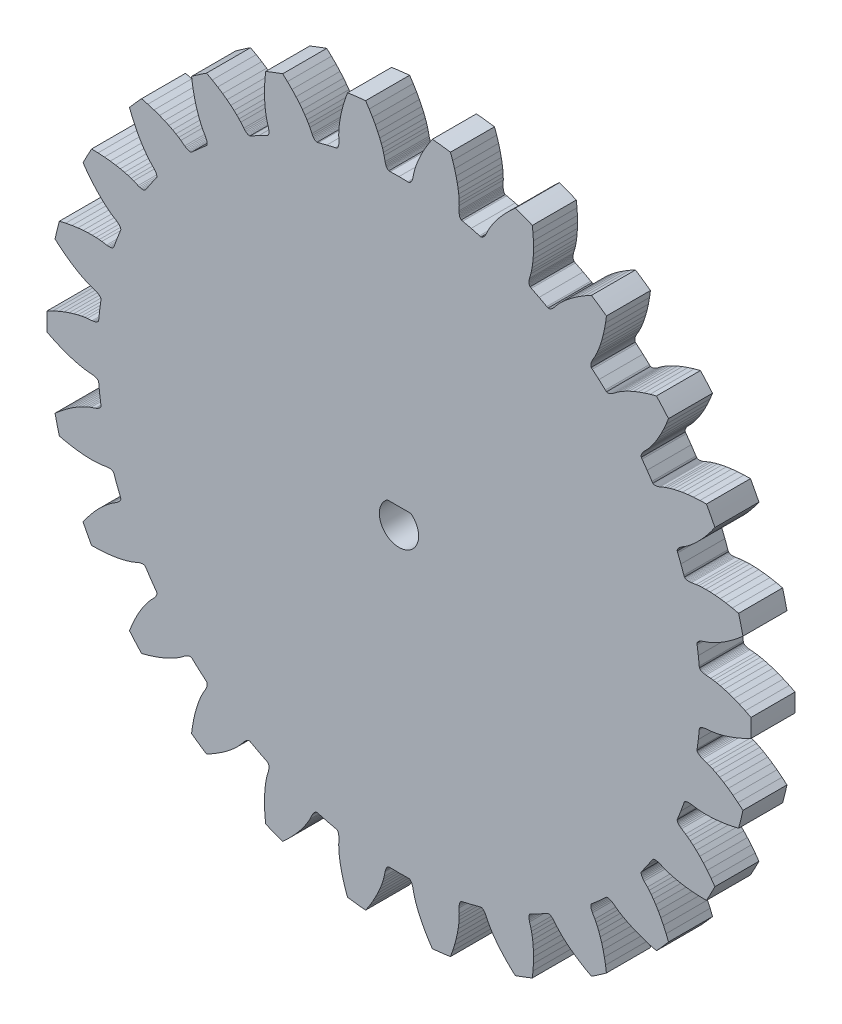
from build123d import *

# Parameters (mm, degrees)
MODEL_R             = 2.5
BOSS_EXTRUDE1_DEPTH = 7
CUT_EXTRUDE1_DEPTH  = 80.327044596


with BuildPart() as part:
    # Model → Boss-Extrude1 (new body)
    with BuildSketch(Plane.XY):
        with BuildLine():
            Line((53.1145369, 10.6909188), (53.9185912, 11.3234084))
            Line((53.9185912, 11.3234084), (54.700837925, 11.992224127))
            ThreePointArc((54.700837925, 11.992224127), (54.372699629, 13.40166681), (54.00825103, 14.802159807))
            Line((54.00825103, 14.802159807), (53.0047917, 15.0308385))
            Line((53.0047917, 15.0308385), (51.9989045, 15.2172176))
            Line((51.9989045, 15.2172176), (51.0709493, 15.3492608))
            Line((51.0709493, 15.3492608), (50.2227788, 15.4339274))
            Line((50.2227788, 15.4339274), (49.4587592, 15.4780067))
            Line((49.4587592, 15.4780067), (48.7788318, 15.48876))
            Line((48.7788318, 15.48876), (48.184081, 15.4732826))
            Line((48.184081, 15.4732826), (47.6758858, 15.4387394))
            Line((47.6758858, 15.4387394), (47.2557344, 15.3924859))
            Line((47.2557344, 15.3924859), (46.5056239, 15.2698861))
            Line((46.5056239, 15.2698861), (46.2943856, 15.2490778))
            Line((46.2943856, 15.2490778), (46.1029098, 15.2433899))
            Line((46.1029098, 15.2433899), (45.9317238, 15.2519957))
            Line((45.9317238, 15.2519957), (45.7813225, 15.2740135))
            Line((45.7813225, 15.2740135), (45.652196, 15.3086023))
            Line((45.652196, 15.3086023), (45.544796, 15.3548533))
            Line((45.544796, 15.3548533), (45.4595411, 15.4118878))
            Line((45.4595411, 15.4118878), (45.3968175, 15.4787721))
            Line((45.3968175, 15.4787721), (45.3570103, 15.5546041))
            Line((45.3570103, 15.5546041), (45.3057091, 15.7038618))
            Line((45.3057091, 15.7038618), (44.8340288, 17.0033043))
            Line((44.8340288, 17.0033043), (44.3253968, 18.2887329))
            Line((44.3253968, 18.2887329), (44.2648202, 18.4344729))
            Line((44.2648202, 18.4344729), (44.2443304, 18.517631))
            Line((44.2443304, 18.517631), (44.2469271, 18.609288))
            Line((44.2469271, 18.609288), (44.2729204, 18.7085134))
            Line((44.2729204, 18.7085134), (44.3226405, 18.8143522))
            Line((44.3226405, 18.8143522), (44.3963564, 18.925869))
            Line((44.3963564, 18.925869), (44.4943329, 19.042084))
            Line((44.4943329, 19.042084), (44.6167607, 19.1620429))
            Line((44.6167607, 19.1620429), (44.7638542, 19.2847575))
            Line((44.7638542, 19.2847575), (44.9357668, 19.4092591))
            Line((44.9357668, 19.4092591), (45.5785313, 19.8149071))
            Line((45.5785313, 19.8149071), (45.9236908, 20.0588977))
            Line((45.9236908, 20.0588977), (46.3269868, 20.3700375))
            Line((46.3269868, 20.3700375), (46.7824276, 20.7528453))
            Line((46.7824276, 20.7528453), (47.2842298, 21.2117694))
            Line((47.2842298, 21.2117694), (47.8268767, 21.751402))
            Line((47.8268767, 21.751402), (48.4055971, 22.3772169))
            Line((48.4055971, 22.3772169), (49.0126207, 23.0914008))
            Line((49.0126207, 23.0914008), (49.6419459, 23.8979342))
            Line((49.6419459, 23.8979342), (50.241403889, 24.734519343))
            ThreePointArc((50.241403889, 24.734519343), (49.585498769, 26.024477381), (48.896480705, 27.297056406))
            Line((48.896480705, 27.297056406), (47.8674537, 27.2789466))
            Line((47.8674537, 27.2789466), (46.8461923, 27.2191853))
            Line((46.8461923, 27.2191853), (45.9136017, 27.1253174))
            Line((45.9136017, 27.1253174), (45.0698155, 27.0045432))
            Line((45.0698155, 27.0045432), (44.3174481, 26.8644998))
            Line((44.3174481, 26.8644998), (43.6547047, 26.7122233))
            Line((43.6547047, 26.7122233), (43.0809402, 26.5548625))
            Line((43.0809402, 26.5548625), (42.595779, 26.3997039))
            Line((42.595779, 26.3997039), (42.1989057, 26.2542458))
            Line((42.1989057, 26.2542458), (41.4999321, 25.9556952))
            Line((41.4999321, 25.9556952), (41.2998117, 25.8849389))
            Line((41.2998117, 25.8849389), (41.115261, 25.8335931))
            Line((41.115261, 25.8335931), (40.9469899, 25.8009814))
            Line((40.9469899, 25.8009814), (40.7956898, 25.786366))
            Line((40.7956898, 25.786366), (40.6620379, 25.7890478))
            Line((40.6620379, 25.7890478), (40.54669, 25.8082523))
            Line((40.54669, 25.8082523), (40.4502632, 25.8432266))
            Line((40.4502632, 25.8432266), (40.3733559, 25.8931567))
            Line((40.3733559, 25.8931567), (40.3165576, 25.9572587))
            Line((40.3165576, 25.9572587), (40.2310274, 26.089902))
            Line((40.2310274, 26.089902), (39.4620764, 27.2387046))
            Line((39.4620764, 27.2387046), (38.660601, 28.3650573))
            Line((38.660601, 28.3650573), (38.5669068, 28.4920654))
            Line((38.5669068, 28.4920654), (38.5271114, 28.5679036))
            Line((38.5271114, 28.5679036), (38.5076977, 28.6575187))
            Line((38.5076977, 28.6575187), (38.5091895, 28.7600814))
            Line((38.5091895, 28.7600814), (38.5321359, 28.8747435))
            Line((38.5321359, 28.8747435), (38.5770221, 29.0006612))
            Line((38.5770221, 29.0006612), (38.6443394, 29.1369465))
            Line((38.6443394, 29.1369465), (38.7345017, 29.2827185))
            Line((38.7345017, 29.2827185), (38.8479534, 29.437069))
            Line((38.8479534, 29.437069), (38.9850754, 29.5990942))
            Line((38.9850754, 29.5990942), (39.5120844, 30.1467784))
            Line((39.5120844, 30.1467784), (39.7888234, 30.4662812))
            Line((39.7888234, 30.4662812), (40.1059397, 30.8648949))
            Line((40.1059397, 30.8648949), (40.4565343, 31.3455731))
            Line((40.4565343, 31.3455731), (40.8339273, 31.9112508))
            Line((40.8339273, 31.9112508), (41.2316633, 32.5650666))
            Line((41.2316633, 32.5650666), (41.6437999, 33.3111933))
            Line((41.6437999, 33.3111933), (42.0622691, 34.1498945))
            Line((42.0622691, 34.1498945), (42.4802912, 35.0835989))
            Line((42.4802912, 35.0835989), (42.86212209, 36.03933398))
            ThreePointArc((42.86212209, 36.03933398), (41.916568958, 37.13483965), (40.943024605, 38.205547261))
            Line((40.943024605, 38.205547261), (39.9482332, 37.9417015))
            Line((39.9482332, 37.9417015), (38.9709496, 37.6392729))
            Line((38.9709496, 37.6392729), (38.0879226, 37.324949))
            Line((38.0879226, 37.324949), (37.2975584, 37.0057531))
            Line((37.2975584, 37.0057531), (36.6005679, 36.6897258))
            Line((36.6005679, 36.6897258), (35.9935249, 36.3832693))
            Line((35.9935249, 36.3832693), (35.4740919, 36.0931703))
            Line((35.4740919, 36.0931703), (35.0401604, 35.8264137))
            Line((35.0401604, 35.8264137), (34.6896299, 35.5902042))
            Line((34.6896299, 35.5902042), (34.082415, 35.1330537))
            Line((34.082415, 35.1330537), (33.9050429, 35.0164615))
            Line((33.9050429, 35.0164615), (33.7381428, 34.9224419))
            Line((33.7381428, 34.9224419), (33.5825658, 34.8505079))
            Line((33.5825658, 34.8505079), (33.4391599, 34.8001087))
            Line((33.4391599, 34.8001087), (33.3087498, 34.7707275))
            Line((33.3087498, 34.7707275), (33.1921579, 34.7617694))
            Line((33.1921579, 34.7617694), (33.0901632, 34.772651))
            Line((33.0901632, 34.772651), (33.0035415, 34.8027251))
            Line((33.0035415, 34.8027251), (32.9330531, 34.8513717))
            Line((32.9330531, 34.8513717), (32.8182646, 34.9596919))
            Line((32.8182646, 34.9596919), (31.7967315, 35.8910904))
            Line((31.7967315, 35.8910904), (30.7489917, 36.7929077))
            Line((30.7489917, 36.7929077), (30.627625, 36.8938027))
            Line((30.627625, 36.8938027), (30.5708367, 36.9579135))
            Line((30.5708367, 36.9579135), (30.5305408, 37.0402785))
            Line((30.5305408, 37.0402785), (30.5074444, 37.140218))
            Line((30.5074444, 37.140218), (30.5022836, 37.2570396))
            Line((30.5022836, 37.2570396), (30.5157314, 37.3900403))
            Line((30.5157314, 37.3900403), (30.5484774, 37.5384756))
            Line((30.5484774, 37.5384756), (30.6011342, 37.7015889))
            Line((30.6011342, 37.7015889), (30.6743508, 37.878605))
            Line((30.6743508, 37.878605), (30.7687131, 38.0687375))
            Line((30.7687131, 38.0687375), (31.1493387, 38.7266285))
            Line((31.1493387, 38.7266285), (31.3415742, 39.1030751))
            Line((31.3415742, 39.1030751), (31.5540812, 39.5659967))
            Line((31.5540812, 39.5659967), (31.7794543, 40.1166101))
            Line((31.7794543, 40.1166101), (32.0105054, 40.7561663))
            Line((32.0105054, 40.7561663), (32.2402156, 41.4861678))
            Line((32.2402156, 41.4861678), (32.4618164, 42.3092442))
            Line((32.4618164, 42.3092442), (32.6674113, 43.2237205))
            Line((32.6674113, 43.2237205), (32.8498364, 44.2303324))
            Line((32.8498364, 44.2303324), (32.991849572, 45.249673828))
            ThreePointArc((32.991849572, 45.249673828), (31.81160102, 46.087060609), (30.610108842, 46.893670685))
            Line((30.610108842, 46.893670685), (29.7073667, 46.3994226))
            Line((29.7073667, 46.3994226), (28.8308571, 45.8719027))
            Line((28.8308571, 45.8719027), (28.0487118, 45.3553904))
            Line((28.0487118, 45.3553904), (27.3577028, 44.8563231))
            Line((27.3577028, 44.8563231), (26.7565959, 44.3826783))
            Line((26.7565959, 44.3826783), (26.2405322, 43.9398519))
            Line((26.2405322, 43.9398519), (25.8056182, 43.5338742))
            Line((25.8056182, 43.5338742), (25.448135, 43.1710225))
            Line((25.448135, 43.1710225), (25.1643189, 42.8577894))
            Line((25.1643189, 42.8577894), (24.6841519, 42.2686068))
            Line((24.6841519, 42.2686068), (24.5398362, 42.1129547))
            Line((24.5398362, 42.1129547), (24.4002863, 41.9817252))
            Line((24.4002863, 41.9817252), (24.266445, 41.8746495))
            Line((24.266445, 41.8746495), (24.1392675, 41.7913956))
            Line((24.1392675, 41.7913956), (24.0196783, 41.731659))
            Line((24.0196783, 41.731659), (23.9086182, 41.6950589))
            Line((23.9086182, 41.6950589), (23.8069831, 41.6812154))
            Line((23.8069831, 41.6812154), (23.7156813, 41.6896856))
            Line((23.7156813, 41.6896856), (23.6355993, 41.7200496))
            Line((23.6355993, 41.7200496), (23.4982236, 41.7977516))
            Line((23.4982236, 41.7977516), (22.2834761, 42.4576164))
            Line((22.2834761, 42.4576164), (21.0503627, 43.0824881))
            Line((21.0503627, 43.0824881), (20.908377, 43.1514063))
            Line((20.908377, 43.1514063), (20.8378961, 43.2000638))
            Line((20.8378961, 43.2000638), (20.7790599, 43.270392))
            Line((20.7790599, 43.270392), (20.7327176, 43.3619001))
            Line((20.7327176, 43.3619001), (20.6997495, 43.474092))
            Line((20.6997495, 43.474092), (20.6809774, 43.6064463))
            Line((20.6809774, 43.6064463), (20.677249, 43.7584049))
            Line((20.677249, 43.7584049), (20.6893401, 43.92938))
            Line((20.6893401, 43.92938), (20.7180664, 44.1187742))
            Line((20.7180664, 44.1187742), (20.764185, 44.3259642))
            Line((20.764185, 44.3259642), (20.9763067, 45.0558278))
            Line((20.9763067, 45.0558278), (21.0728666, 45.4673405))
            Line((21.0728666, 45.4673405), (21.1684141, 45.9676667))
            Line((21.1684141, 45.9676667), (21.2554679, 46.5562155))
            Line((21.2554679, 46.5562155), (21.3267493, 47.2324816))
            Line((21.3267493, 47.2324816), (21.3750837, 47.9962438))
            Line((21.3750837, 47.9962438), (21.3932701, 48.8484356))
            Line((21.3932701, 48.8484356), (21.3740423, 49.785541))
            Line((21.3740423, 49.785541), (21.3102684, 50.8065597))
            Line((21.3102684, 50.8065597), (21.20421064, 51.830266876))
            ThreePointArc((21.20421064, 51.830266876), (19.857858064, 52.360868552), (18.498244695, 52.856504393))
            Line((18.498244695, 52.856504393), (17.740016, 52.1605779))
            Line((17.740016, 52.1605779), (17.0152199, 51.4386243))
            Line((17.0152199, 51.4386243), (16.3794118, 50.7499412))
            Line((16.3794118, 50.7499412), (15.8279169, 50.1000067))
            Line((15.8279169, 50.1000067), (15.3576277, 49.4962708))
            Line((15.3576277, 49.4962708), (14.9625352, 48.9428101))
            Line((14.9625352, 48.9428101), (14.6374158, 48.4445476))
            Line((14.6374158, 48.4445476), (14.3771566, 48.0066883))
            Line((14.3771566, 48.0066883), (14.1765492, 47.6346356))
            Line((14.1765492, 47.6346356), (13.8513356, 46.9476622))
            Line((13.8513356, 46.9476622), (13.7484635, 46.7619959))
            Line((13.7484635, 46.7619959), (13.6443738, 46.6011833))
            Line((13.6443738, 46.6011833), (13.5400466, 46.4651887))
            Line((13.5400466, 46.4651887), (13.4364887, 46.3539184))
            Line((13.4364887, 46.3539184), (13.3346705, 46.2672981))
            Line((13.3346705, 46.2672981), (13.2355965, 46.2051831))
            Line((13.2355965, 46.2051831), (13.1402277, 46.167419))
            Line((13.1402277, 46.167419), (13.0495519, 46.1537932))
            Line((13.0495519, 46.1537932), (12.9645303, 46.1641099))
            Line((12.9645303, 46.1641099), (12.8125513, 46.2066779))
            Line((12.8125513, 46.2066779), (11.4751861, 46.5566601))
            Line((11.4751861, 46.5566601), (10.1283632, 46.8682708))
            Line((10.1283632, 46.8682708), (9.9740101, 46.901207))
            Line((9.9740101, 46.901207), (9.8939328, 46.9315834))
            Line((9.8939328, 46.9315834), (9.8199756, 46.9857876))
            Line((9.8199756, 46.9857876), (9.7530806, 47.0635462))
            Line((9.7530806, 47.0635462), (9.6942212, 47.1645882))
            Line((9.6942212, 47.1645882), (9.6443201, 47.288604))
            Line((9.6443201, 47.288604), (9.604334, 47.4352547))
            Line((9.604334, 47.4352547), (9.5751567, 47.6041553))
            Line((9.5751567, 47.6041553), (9.5577233, 47.7949206))
            Line((9.5577233, 47.7949206), (9.5529179, 48.007127))
            Line((9.5529179, 48.007127), (9.584208, 48.7665461))
            Line((9.584208, 48.7665461), (9.5794806, 49.1892093))
            Line((9.5794806, 49.1892093), (9.5525158, 49.6978629))
            Line((9.5525158, 49.6978629), (9.496191, 50.2901429))
            Line((9.496191, 50.2901429), (9.40356, 50.9638167))
            Line((9.40356, 50.9638167), (9.2677097, 51.7169526))
            Line((9.2677097, 51.7169526), (9.0814248, 52.5487335))
            Line((9.0814248, 52.5487335), (8.8384916, 53.4540068))
            Line((8.8384916, 53.4540068), (8.5322252, 54.4300945))
            Line((8.5322252, 54.4300945), (8.184260089, 55.398673248))
            ThreePointArc((8.184260089, 55.398673248), (6.750048811, 55.591653611), (5.311329885, 55.747510147))
            Line((5.311329885, 55.747510147), (4.74168, 54.89035))
            Line((4.74168, 54.89035), (4.21072, 54.01592))
            Line((4.21072, 54.01592), (3.7582, 53.19509))
            Line((3.7582, 53.19509), (3.37827, 52.43206))
            Line((3.37827, 52.43206), (3.06613, 51.73332))
            Line((3.06613, 51.73332), (2.81497, 51.10139))
            Line((2.81497, 51.10139), (2.61854, 50.5398))
            Line((2.61854, 50.5398), (2.47063, 50.05238))
            Line((2.47063, 50.05238), (2.36489, 49.64313))
            Line((2.36489, 49.64313), (2.21353, 48.89829))
            Line((2.21353, 48.89829), (2.15808, 48.6934))
            Line((2.15808, 48.6934), (2.0955, 48.51235))
            Line((2.0955, 48.51235), (2.02675, 48.35534))
            Line((2.02675, 48.35534), (1.95283, 48.22252))
            Line((1.95283, 48.22252), (1.8747, 48.11405))
            Line((1.8747, 48.11405), (1.79337, 48.03003))
            Line((1.79337, 48.03003), (1.70981, 47.97054))
            Line((1.70981, 47.97054), (1.62503, 47.93561))
            Line((1.62503, 47.93561), (1.54001, 47.92528))
            Line((1.54001, 47.92528), (1.38226, 47.93024))
            Line((1.38226, 47.93024), (0, 47.95))
            Line((0, 47.95), (-1.38226, 47.93024))
            Line((-1.38226, 47.93024), (-1.54001, 47.92528))
            Line((-1.54001, 47.92528), (-1.62503, 47.93561))
            Line((-1.62503, 47.93561), (-1.70981, 47.97054))
            Line((-1.70981, 47.97054), (-1.79337, 48.03003))
            Line((-1.79337, 48.03003), (-1.8747, 48.11405))
            Line((-1.8747, 48.11405), (-1.95283, 48.22252))
            Line((-1.95283, 48.22252), (-2.02675, 48.35534))
            Line((-2.02675, 48.35534), (-2.0955, 48.51235))
            Line((-2.0955, 48.51235), (-2.15808, 48.6934))
            Line((-2.15808, 48.6934), (-2.21353, 48.89829))
            Line((-2.21353, 48.89829), (-2.36489, 49.64313))
            Line((-2.36489, 49.64313), (-2.47063, 50.05238))
            Line((-2.47063, 50.05238), (-2.61854, 50.5398))
            Line((-2.61854, 50.5398), (-2.81497, 51.10139))
            Line((-2.81497, 51.10139), (-3.06613, 51.73332))
            Line((-3.06613, 51.73332), (-3.37827, 52.43206))
            Line((-3.37827, 52.43206), (-3.7582, 53.19509))
            Line((-3.7582, 53.19509), (-4.21072, 54.01592))
            Line((-4.21072, 54.01592), (-4.74168, 54.89035))
            Line((-4.74168, 54.89035), (-5.311329885, 55.747510247))
            ThreePointArc((-5.311329885, 55.747510247), (-6.750048811, 55.591653711), (-8.184260089, 55.398673348))
            Line((-8.184260089, 55.398673348), (-8.5322252, 54.4300945))
            Line((-8.5322252, 54.4300945), (-8.8384916, 53.4540068))
            Line((-8.8384916, 53.4540068), (-9.0814248, 52.5487335))
            Line((-9.0814248, 52.5487335), (-9.2677097, 51.7169526))
            Line((-9.2677097, 51.7169526), (-9.40356, 50.9638167))
            Line((-9.40356, 50.9638167), (-9.496191, 50.2901429))
            Line((-9.496191, 50.2901429), (-9.5525158, 49.6978629))
            Line((-9.5525158, 49.6978629), (-9.5794806, 49.1892093))
            Line((-9.5794806, 49.1892093), (-9.584208, 48.7665461))
            Line((-9.584208, 48.7665461), (-9.5529179, 48.007127))
            Line((-9.5529179, 48.007127), (-9.5577233, 47.7949206))
            Line((-9.5577233, 47.7949206), (-9.5751567, 47.6041553))
            Line((-9.5751567, 47.6041553), (-9.604334, 47.4352547))
            Line((-9.604334, 47.4352547), (-9.6443201, 47.288604))
            Line((-9.6443201, 47.288604), (-9.6942212, 47.1645882))
            Line((-9.6942212, 47.1645882), (-9.7530806, 47.0635462))
            Line((-9.7530806, 47.0635462), (-9.8199756, 46.9857876))
            Line((-9.8199756, 46.9857876), (-9.8939328, 46.9315834))
            Line((-9.8939328, 46.9315834), (-9.9740101, 46.901207))
            Line((-9.9740101, 46.901207), (-10.1283632, 46.8682708))
            Line((-10.1283632, 46.8682708), (-11.4751861, 46.5566601))
            Line((-11.4751861, 46.5566601), (-12.8125513, 46.2066779))
            Line((-12.8125513, 46.2066779), (-12.9645303, 46.1641099))
            Line((-12.9645303, 46.1641099), (-13.0495519, 46.1537932))
            Line((-13.0495519, 46.1537932), (-13.1402277, 46.167419))
            Line((-13.1402277, 46.167419), (-13.2355965, 46.2051831))
            Line((-13.2355965, 46.2051831), (-13.3346705, 46.2672981))
            Line((-13.3346705, 46.2672981), (-13.4364887, 46.3539184))
            Line((-13.4364887, 46.3539184), (-13.5400466, 46.4651887))
            Line((-13.5400466, 46.4651887), (-13.6443738, 46.6011833))
            Line((-13.6443738, 46.6011833), (-13.7484635, 46.7619959))
            Line((-13.7484635, 46.7619959), (-13.8513356, 46.9476622))
            Line((-13.8513356, 46.9476622), (-14.1765492, 47.6346356))
            Line((-14.1765492, 47.6346356), (-14.3771566, 48.0066883))
            Line((-14.3771566, 48.0066883), (-14.6374158, 48.4445476))
            Line((-14.6374158, 48.4445476), (-14.9625352, 48.9428101))
            Line((-14.9625352, 48.9428101), (-15.3576277, 49.4962708))
            Line((-15.3576277, 49.4962708), (-15.8279169, 50.1000067))
            Line((-15.8279169, 50.1000067), (-16.3794118, 50.7499412))
            Line((-16.3794118, 50.7499412), (-17.0152199, 51.4386243))
            Line((-17.0152199, 51.4386243), (-17.740016, 52.1605779))
            Line((-17.740016, 52.1605779), (-18.498244795, 52.856504393))
            ThreePointArc((-18.498244795, 52.856504393), (-19.857858172, 52.360868572), (-21.20421074, 51.830266876))
            Line((-21.20421074, 51.830266876), (-21.3102684, 50.8065597))
            Line((-21.3102684, 50.8065597), (-21.3740423, 49.785541))
            Line((-21.3740423, 49.785541), (-21.3932701, 48.8484356))
            Line((-21.3932701, 48.8484356), (-21.3750837, 47.9962438))
            Line((-21.3750837, 47.9962438), (-21.3267493, 47.2324816))
            Line((-21.3267493, 47.2324816), (-21.2554679, 46.5562155))
            Line((-21.2554679, 46.5562155), (-21.1684141, 45.9676667))
            Line((-21.1684141, 45.9676667), (-21.0728666, 45.4673405))
            Line((-21.0728666, 45.4673405), (-20.9763067, 45.0558278))
            Line((-20.9763067, 45.0558278), (-20.764185, 44.3259642))
            Line((-20.764185, 44.3259642), (-20.7180664, 44.1187742))
            Line((-20.7180664, 44.1187742), (-20.6893401, 43.92938))
            Line((-20.6893401, 43.92938), (-20.677249, 43.7584049))
            Line((-20.677249, 43.7584049), (-20.6809774, 43.6064463))
            Line((-20.6809774, 43.6064463), (-20.6997495, 43.474092))
            Line((-20.6997495, 43.474092), (-20.7327176, 43.3619001))
            Line((-20.7327176, 43.3619001), (-20.7790599, 43.270392))
            Line((-20.7790599, 43.270392), (-20.8378961, 43.2000638))
            Line((-20.8378961, 43.2000638), (-20.908377, 43.1514063))
            Line((-20.908377, 43.1514063), (-21.0503627, 43.0824881))
            Line((-21.0503627, 43.0824881), (-22.2834761, 42.4576164))
            Line((-22.2834761, 42.4576164), (-23.4982236, 41.7977516))
            Line((-23.4982236, 41.7977516), (-23.6355993, 41.7200496))
            Line((-23.6355993, 41.7200496), (-23.7156813, 41.6896856))
            Line((-23.7156813, 41.6896856), (-23.8069831, 41.6812154))
            Line((-23.8069831, 41.6812154), (-23.9086182, 41.6950589))
            Line((-23.9086182, 41.6950589), (-24.0196783, 41.731659))
            Line((-24.0196783, 41.731659), (-24.1392675, 41.7913956))
            Line((-24.1392675, 41.7913956), (-24.266445, 41.8746495))
            Line((-24.266445, 41.8746495), (-24.4002863, 41.9817252))
            Line((-24.4002863, 41.9817252), (-24.5398362, 42.1129547))
            Line((-24.5398362, 42.1129547), (-24.6841519, 42.2686068))
            Line((-24.6841519, 42.2686068), (-25.1643189, 42.8577894))
            Line((-25.1643189, 42.8577894), (-25.448135, 43.1710225))
            Line((-25.448135, 43.1710225), (-25.8056182, 43.5338742))
            Line((-25.8056182, 43.5338742), (-26.2405322, 43.9398519))
            Line((-26.2405322, 43.9398519), (-26.7565959, 44.3826783))
            Line((-26.7565959, 44.3826783), (-27.3577028, 44.8563231))
            Line((-27.3577028, 44.8563231), (-28.0487118, 45.3553904))
            Line((-28.0487118, 45.3553904), (-28.8308571, 45.8719027))
            Line((-28.8308571, 45.8719027), (-29.7073667, 46.3994226))
            Line((-29.7073667, 46.3994226), (-30.610108778, 46.893670592))
            ThreePointArc((-30.610108778, 46.893670592), (-31.811600999, 46.087060493), (-32.991849593, 45.249673686))
            Line((-32.991849593, 45.249673686), (-32.8498364, 44.2303324))
            Line((-32.8498364, 44.2303324), (-32.6674113, 43.2237205))
            Line((-32.6674113, 43.2237205), (-32.4618164, 42.3092442))
            Line((-32.4618164, 42.3092442), (-32.2402156, 41.4861678))
            Line((-32.2402156, 41.4861678), (-32.0105054, 40.7561663))
            Line((-32.0105054, 40.7561663), (-31.7794543, 40.1166101))
            Line((-31.7794543, 40.1166101), (-31.5540812, 39.5659967))
            Line((-31.5540812, 39.5659967), (-31.3415742, 39.1030751))
            Line((-31.3415742, 39.1030751), (-31.1493387, 38.7266285))
            Line((-31.1493387, 38.7266285), (-30.7687131, 38.0687375))
            Line((-30.7687131, 38.0687375), (-30.6743508, 37.878605))
            Line((-30.6743508, 37.878605), (-30.6011342, 37.7015889))
            Line((-30.6011342, 37.7015889), (-30.5484774, 37.5384756))
            Line((-30.5484774, 37.5384756), (-30.5157314, 37.3900403))
            Line((-30.5157314, 37.3900403), (-30.5022836, 37.2570396))
            Line((-30.5022836, 37.2570396), (-30.5074444, 37.140218))
            Line((-30.5074444, 37.140218), (-30.5305408, 37.0402785))
            Line((-30.5305408, 37.0402785), (-30.5708367, 36.9579135))
            Line((-30.5708367, 36.9579135), (-30.627625, 36.8938027))
            Line((-30.627625, 36.8938027), (-30.7489917, 36.7929077))
            Line((-30.7489917, 36.7929077), (-31.7967315, 35.8910904))
            Line((-31.7967315, 35.8910904), (-32.8182646, 34.9596919))
            Line((-32.8182646, 34.9596919), (-32.9330531, 34.8513717))
            Line((-32.9330531, 34.8513717), (-33.0035415, 34.8027251))
            Line((-33.0035415, 34.8027251), (-33.0901632, 34.772651))
            Line((-33.0901632, 34.772651), (-33.1921579, 34.7617694))
            Line((-33.1921579, 34.7617694), (-33.3087498, 34.7707275))
            Line((-33.3087498, 34.7707275), (-33.4391599, 34.8001087))
            Line((-33.4391599, 34.8001087), (-33.5825658, 34.8505079))
            Line((-33.5825658, 34.8505079), (-33.7381428, 34.9224419))
            Line((-33.7381428, 34.9224419), (-33.9050429, 35.0164615))
            Line((-33.9050429, 35.0164615), (-34.082415, 35.1330537))
            Line((-34.082415, 35.1330537), (-34.6896299, 35.5902042))
            Line((-34.6896299, 35.5902042), (-35.0401604, 35.8264137))
            Line((-35.0401604, 35.8264137), (-35.4740919, 36.0931703))
            Line((-35.4740919, 36.0931703), (-35.9935249, 36.3832693))
            Line((-35.9935249, 36.3832693), (-36.6005679, 36.6897258))
            Line((-36.6005679, 36.6897258), (-37.2975584, 37.0057531))
            Line((-37.2975584, 37.0057531), (-38.0879226, 37.324949))
            Line((-38.0879226, 37.324949), (-38.9709496, 37.6392729))
            Line((-38.9709496, 37.6392729), (-39.9482332, 37.9417015))
            Line((-39.9482332, 37.9417015), (-40.943024605, 38.205547461))
            ThreePointArc((-40.943024605, 38.205547461), (-41.916569017, 37.134839837), (-42.862122153, 36.039334105))
            Line((-42.862122153, 36.039334105), (-42.4802912, 35.0835989))
            Line((-42.4802912, 35.0835989), (-42.0622691, 34.1498945))
            Line((-42.0622691, 34.1498945), (-41.6437999, 33.3111933))
            Line((-41.6437999, 33.3111933), (-41.2316633, 32.5650666))
            Line((-41.2316633, 32.5650666), (-40.8339273, 31.9112508))
            Line((-40.8339273, 31.9112508), (-40.4565343, 31.3455731))
            Line((-40.4565343, 31.3455731), (-40.1059397, 30.8648949))
            Line((-40.1059397, 30.8648949), (-39.7888234, 30.4662812))
            Line((-39.7888234, 30.4662812), (-39.5120844, 30.1467784))
            Line((-39.5120844, 30.1467784), (-38.9850754, 29.5990942))
            Line((-38.9850754, 29.5990942), (-38.8479534, 29.437069))
            Line((-38.8479534, 29.437069), (-38.7345017, 29.2827185))
            Line((-38.7345017, 29.2827185), (-38.6443394, 29.1369465))
            Line((-38.6443394, 29.1369465), (-38.5770221, 29.0006612))
            Line((-38.5770221, 29.0006612), (-38.5321359, 28.8747435))
            Line((-38.5321359, 28.8747435), (-38.5091895, 28.7600814))
            Line((-38.5091895, 28.7600814), (-38.5076977, 28.6575187))
            Line((-38.5076977, 28.6575187), (-38.5271114, 28.5679036))
            Line((-38.5271114, 28.5679036), (-38.5669068, 28.4920654))
            Line((-38.5669068, 28.4920654), (-38.660601, 28.3650573))
            Line((-38.660601, 28.3650573), (-39.4620764, 27.2387046))
            Line((-39.4620764, 27.2387046), (-40.2310274, 26.089902))
            Line((-40.2310274, 26.089902), (-40.3165576, 25.9572587))
            Line((-40.3165576, 25.9572587), (-40.3733559, 25.8931567))
            Line((-40.3733559, 25.8931567), (-40.4502632, 25.8432266))
            Line((-40.4502632, 25.8432266), (-40.54669, 25.8082523))
            Line((-40.54669, 25.8082523), (-40.6620379, 25.7890478))
            Line((-40.6620379, 25.7890478), (-40.7956898, 25.786366))
            Line((-40.7956898, 25.786366), (-40.9469899, 25.8009814))
            Line((-40.9469899, 25.8009814), (-41.115261, 25.8335931))
            Line((-41.115261, 25.8335931), (-41.2998117, 25.8849389))
            Line((-41.2998117, 25.8849389), (-41.4999321, 25.9556952))
            Line((-41.4999321, 25.9556952), (-42.1989057, 26.2542458))
            Line((-42.1989057, 26.2542458), (-42.595779, 26.3997039))
            Line((-42.595779, 26.3997039), (-43.0809402, 26.5548625))
            Line((-43.0809402, 26.5548625), (-43.6547047, 26.7122233))
            Line((-43.6547047, 26.7122233), (-44.3174481, 26.8644998))
            Line((-44.3174481, 26.8644998), (-45.0698155, 27.0045432))
            Line((-45.0698155, 27.0045432), (-45.9136017, 27.1253174))
            Line((-45.9136017, 27.1253174), (-46.8461923, 27.2191853))
            Line((-46.8461923, 27.2191853), (-47.8674537, 27.2789466))
            Line((-47.8674537, 27.2789466), (-48.896480705, 27.297056406))
            ThreePointArc((-48.896480705, 27.297056406), (-49.585498769, 26.024477381), (-50.241403889, 24.734519343))
            Line((-50.241403889, 24.734519343), (-49.6419459, 23.8979342))
            Line((-49.6419459, 23.8979342), (-49.0126207, 23.0914008))
            Line((-49.0126207, 23.0914008), (-48.4055971, 22.3772169))
            Line((-48.4055971, 22.3772169), (-47.8268767, 21.751402))
            Line((-47.8268767, 21.751402), (-47.2842298, 21.2117694))
            Line((-47.2842298, 21.2117694), (-46.7824276, 20.7528453))
            Line((-46.7824276, 20.7528453), (-46.3269868, 20.3700375))
            Line((-46.3269868, 20.3700375), (-45.9236908, 20.0588977))
            Line((-45.9236908, 20.0588977), (-45.5785313, 19.8149071))
            Line((-45.5785313, 19.8149071), (-44.9357668, 19.4092591))
            Line((-44.9357668, 19.4092591), (-44.7638542, 19.2847575))
            Line((-44.7638542, 19.2847575), (-44.6167607, 19.1620429))
            Line((-44.6167607, 19.1620429), (-44.4943329, 19.042084))
            Line((-44.4943329, 19.042084), (-44.3963564, 18.925869))
            Line((-44.3963564, 18.925869), (-44.3226405, 18.8143522))
            Line((-44.3226405, 18.8143522), (-44.2729204, 18.7085134))
            Line((-44.2729204, 18.7085134), (-44.2469271, 18.609288))
            Line((-44.2469271, 18.609288), (-44.2443304, 18.517631))
            Line((-44.2443304, 18.517631), (-44.2648202, 18.4344729))
            Line((-44.2648202, 18.4344729), (-44.3253968, 18.2887329))
            Line((-44.3253968, 18.2887329), (-44.8340288, 17.0033043))
            Line((-44.8340288, 17.0033043), (-45.3057091, 15.7038618))
            Line((-45.3057091, 15.7038618), (-45.3570103, 15.5546041))
            Line((-45.3570103, 15.5546041), (-45.3968175, 15.4787721))
            Line((-45.3968175, 15.4787721), (-45.4595411, 15.4118878))
            Line((-45.4595411, 15.4118878), (-45.544796, 15.3548533))
            Line((-45.544796, 15.3548533), (-45.652196, 15.3086023))
            Line((-45.652196, 15.3086023), (-45.7813225, 15.2740135))
            Line((-45.7813225, 15.2740135), (-45.9317238, 15.2519957))
            Line((-45.9317238, 15.2519957), (-46.1029098, 15.2433899))
            Line((-46.1029098, 15.2433899), (-46.2943856, 15.2490778))
            Line((-46.2943856, 15.2490778), (-46.5056239, 15.2698861))
            Line((-46.5056239, 15.2698861), (-47.2557344, 15.3924859))
            Line((-47.2557344, 15.3924859), (-47.6758858, 15.4387394))
            Line((-47.6758858, 15.4387394), (-48.184081, 15.4732826))
            Line((-48.184081, 15.4732826), (-48.7788318, 15.48876))
            Line((-48.7788318, 15.48876), (-49.4587592, 15.4780067))
            Line((-49.4587592, 15.4780067), (-50.2227788, 15.4339274))
            Line((-50.2227788, 15.4339274), (-51.0709493, 15.3492608))
            Line((-51.0709493, 15.3492608), (-51.9989045, 15.2172176))
            Line((-51.9989045, 15.2172176), (-53.0047917, 15.0308385))
            Line((-53.0047917, 15.0308385), (-54.00825113, 14.802159807))
            ThreePointArc((-54.00825113, 14.802159807), (-54.372699485, 13.40166675), (-54.700838025, 11.992224127))
            Line((-54.700838025, 11.992224127), (-53.9185912, 11.3234084))
            Line((-53.9185912, 11.3234084), (-53.1145369, 10.6909188))
            Line((-53.1145369, 10.6909188), (-52.3542369, 10.142758))
            Line((-52.3542369, 10.142758), (-51.6425658, 9.6736251))
            Line((-51.6425658, 9.6736251), (-50.9865447, 9.2795371))
            Line((-50.9865447, 9.2795371), (-50.3894962, 8.9540376))
            Line((-50.3894962, 8.9540376), (-49.8556778, 8.6913476))
            Line((-49.8556778, 8.6913476), (-49.3896403, 8.485764))
            Line((-49.3896403, 8.485764), (-48.9961197, 8.3314654))
            Line((-48.9961197, 8.3314654), (-48.2749549, 8.0914284))
            Line((-48.2749549, 8.0914284), (-48.0782425, 8.011686))
            Line((-48.0782425, 8.011686), (-47.9060557, 7.9277391))
            Line((-47.9060557, 7.9277391), (-47.7584774, 7.8405649))
            Line((-47.7584774, 7.8405649), (-47.6355359, 7.7511741))
            Line((-47.6355359, 7.7511741), (-47.5372743, 7.6605392))
            Line((-47.5372743, 7.6605392), (-47.4636701, 7.5696747))
            Line((-47.4636701, 7.5696747), (-47.4146859, 7.4795532))
            Line((-47.4146859, 7.4795532), (-47.3902297, 7.391181))
            Line((-47.3902297, 7.391181), (-47.3902231, 7.3055357))
            Line((-47.3902231, 7.3055357), (-47.4141616, 7.1495338))
            Line((-47.4141616, 7.1495338), (-47.6003905, 5.7797338))
            Line((-47.6003905, 5.7797338), (-47.7473876, 4.4051702))
            Line((-47.7473876, 4.4051702), (-47.7614784, 4.2479726))
            Line((-47.7614784, 4.2479726), (-47.7819812, 4.1648176))
            Line((-47.7819812, 4.1648176), (-47.8268756, 4.0848661))
            Line((-47.8268756, 4.0848661), (-47.8960039, 4.0090861))
            Line((-47.8960039, 4.0090861), (-47.9892145, 3.9384765))
            Line((-47.9892145, 3.9384765), (-48.1063112, 3.8739908))
            Line((-48.1063112, 3.8739908), (-48.2470728, 3.8166194))
            Line((-48.2470728, 3.8166194), (-48.411225, 3.7672962))
            Line((-48.411225, 3.7672962), (-48.5984981, 3.7269956))
            Line((-48.5984981, 3.7269956), (-48.808578, 3.6966467))
            Line((-48.808578, 3.6966467), (-49.5662317, 3.6361708))
            Line((-49.5662317, 3.6361708), (-49.9852433, 3.5805314))
            Line((-49.9852433, 3.5805314), (-50.4869381, 3.4924518))
            Line((-50.4869381, 3.4924518), (-51.0681105, 3.3651462))
            Line((-51.0681105, 3.3651462), (-51.725707, 3.1919882))
            Line((-51.725707, 3.1919882), (-52.4569767, 2.9663478))
            Line((-52.4569767, 2.9663478), (-53.2602389, 2.6811611))
            Line((-53.2602389, 2.6811611), (-54.1296293, 2.3308806))
            Line((-54.1296293, 2.3308806), (-55.0616839, 1.9091928))
            Line((-55.0616839, 1.9091928), (-55.981258057, 1.447015426))
            ThreePointArc((-55.981258057, 1.447015426), (-55.999956052, -4.9e-08), (-55.981258054, -1.447015524))
            Line((-55.981258054, -1.447015524), (-55.0616839, -1.9091928))
            Line((-55.0616839, -1.9091928), (-54.1296293, -2.3308806))
            Line((-54.1296293, -2.3308806), (-53.2602389, -2.6811611))
            Line((-53.2602389, -2.6811611), (-52.4569767, -2.9663478))
            Line((-52.4569767, -2.9663478), (-51.725707, -3.1919882))
            Line((-51.725707, -3.1919882), (-51.0681105, -3.3651462))
            Line((-51.0681105, -3.3651462), (-50.4869381, -3.4924518))
            Line((-50.4869381, -3.4924518), (-49.9852433, -3.5805314))
            Line((-49.9852433, -3.5805314), (-49.5662317, -3.6361708))
            Line((-49.5662317, -3.6361708), (-48.808578, -3.6966467))
            Line((-48.808578, -3.6966467), (-48.5984981, -3.7269956))
            Line((-48.5984981, -3.7269956), (-48.411225, -3.7672962))
            Line((-48.411225, -3.7672962), (-48.2470728, -3.8166194))
            Line((-48.2470728, -3.8166194), (-48.1063112, -3.8739908))
            Line((-48.1063112, -3.8739908), (-47.9892145, -3.9384765))
            Line((-47.9892145, -3.9384765), (-47.8960039, -4.0090861))
            Line((-47.8960039, -4.0090861), (-47.8268756, -4.0848661))
            Line((-47.8268756, -4.0848661), (-47.7819812, -4.1648176))
            Line((-47.7819812, -4.1648176), (-47.7614784, -4.2479726))
            Line((-47.7614784, -4.2479726), (-47.7473876, -4.4051702))
            Line((-47.7473876, -4.4051702), (-47.6003905, -5.7797338))
            Line((-47.6003905, -5.7797338), (-47.4141616, -7.1495338))
            Line((-47.4141616, -7.1495338), (-47.3902231, -7.3055357))
            Line((-47.3902231, -7.3055357), (-47.3902297, -7.391181))
            Line((-47.3902297, -7.391181), (-47.4146859, -7.4795532))
            Line((-47.4146859, -7.4795532), (-47.4636701, -7.5696747))
            Line((-47.4636701, -7.5696747), (-47.5372743, -7.6605392))
            Line((-47.5372743, -7.6605392), (-47.6355359, -7.7511741))
            Line((-47.6355359, -7.7511741), (-47.7584774, -7.8405649))
            Line((-47.7584774, -7.8405649), (-47.9060557, -7.9277391))
            Line((-47.9060557, -7.9277391), (-48.0782425, -8.011686))
            Line((-48.0782425, -8.011686), (-48.2749549, -8.0914284))
            Line((-48.2749549, -8.0914284), (-48.9961197, -8.3314654))
            Line((-48.9961197, -8.3314654), (-49.3896403, -8.485764))
            Line((-49.3896403, -8.485764), (-49.8556778, -8.6913476))
            Line((-49.8556778, -8.6913476), (-50.3894962, -8.9540376))
            Line((-50.3894962, -8.9540376), (-50.9865447, -9.2795371))
            Line((-50.9865447, -9.2795371), (-51.6425658, -9.6736251))
            Line((-51.6425658, -9.6736251), (-52.3542369, -10.142758))
            Line((-52.3542369, -10.142758), (-53.1145369, -10.6909188))
            Line((-53.1145369, -10.6909188), (-53.9185912, -11.3234084))
            Line((-53.9185912, -11.3234084), (-54.700837925, -11.992224127))
            ThreePointArc((-54.700837925, -11.992224127), (-54.372699385, -13.40166675), (-54.00825103, -14.802159807))
            Line((-54.00825103, -14.802159807), (-53.0047917, -15.0308385))
            Line((-53.0047917, -15.0308385), (-51.9989045, -15.2172176))
            Line((-51.9989045, -15.2172176), (-51.0709493, -15.3492608))
            Line((-51.0709493, -15.3492608), (-50.2227788, -15.4339274))
            Line((-50.2227788, -15.4339274), (-49.4587592, -15.4780067))
            Line((-49.4587592, -15.4780067), (-48.7788318, -15.48876))
            Line((-48.7788318, -15.48876), (-48.184081, -15.4732826))
            Line((-48.184081, -15.4732826), (-47.6758858, -15.4387394))
            Line((-47.6758858, -15.4387394), (-47.2557344, -15.3924859))
            Line((-47.2557344, -15.3924859), (-46.5056239, -15.2698861))
            Line((-46.5056239, -15.2698861), (-46.2943856, -15.2490778))
            Line((-46.2943856, -15.2490778), (-46.1029098, -15.2433899))
            Line((-46.1029098, -15.2433899), (-45.9317238, -15.2519957))
            Line((-45.9317238, -15.2519957), (-45.7813225, -15.2740135))
            Line((-45.7813225, -15.2740135), (-45.652196, -15.3086023))
            Line((-45.652196, -15.3086023), (-45.544796, -15.3548533))
            Line((-45.544796, -15.3548533), (-45.4595411, -15.4118878))
            Line((-45.4595411, -15.4118878), (-45.3968175, -15.4787721))
            Line((-45.3968175, -15.4787721), (-45.3570103, -15.5546041))
            Line((-45.3570103, -15.5546041), (-45.3057091, -15.7038618))
            Line((-45.3057091, -15.7038618), (-44.8340288, -17.0033043))
            Line((-44.8340288, -17.0033043), (-44.3253968, -18.2887329))
            Line((-44.3253968, -18.2887329), (-44.2648202, -18.4344729))
            Line((-44.2648202, -18.4344729), (-44.2443304, -18.517631))
            Line((-44.2443304, -18.517631), (-44.2469271, -18.609288))
            Line((-44.2469271, -18.609288), (-44.2729204, -18.7085134))
            Line((-44.2729204, -18.7085134), (-44.3226405, -18.8143522))
            Line((-44.3226405, -18.8143522), (-44.3963564, -18.925869))
            Line((-44.3963564, -18.925869), (-44.4943329, -19.042084))
            Line((-44.4943329, -19.042084), (-44.6167607, -19.1620429))
            Line((-44.6167607, -19.1620429), (-44.7638542, -19.2847575))
            Line((-44.7638542, -19.2847575), (-44.9357668, -19.4092591))
            Line((-44.9357668, -19.4092591), (-45.5785313, -19.8149071))
            Line((-45.5785313, -19.8149071), (-45.9236908, -20.0588977))
            Line((-45.9236908, -20.0588977), (-46.3269868, -20.3700375))
            Line((-46.3269868, -20.3700375), (-46.7824276, -20.7528453))
            Line((-46.7824276, -20.7528453), (-47.2842298, -21.2117694))
            Line((-47.2842298, -21.2117694), (-47.8268767, -21.751402))
            Line((-47.8268767, -21.751402), (-48.4055971, -22.3772169))
            Line((-48.4055971, -22.3772169), (-49.0126207, -23.0914008))
            Line((-49.0126207, -23.0914008), (-49.6419459, -23.8979342))
            Line((-49.6419459, -23.8979342), (-50.241403889, -24.734519343))
            ThreePointArc((-50.241403889, -24.734519343), (-49.585498769, -26.024477381), (-48.896480705, -27.297056406))
            Line((-48.896480705, -27.297056406), (-47.8674537, -27.2789466))
            Line((-47.8674537, -27.2789466), (-46.8461923, -27.2191853))
            Line((-46.8461923, -27.2191853), (-45.9136017, -27.1253174))
            Line((-45.9136017, -27.1253174), (-45.0698155, -27.0045432))
            Line((-45.0698155, -27.0045432), (-44.3174481, -26.8644998))
            Line((-44.3174481, -26.8644998), (-43.6547047, -26.7122233))
            Line((-43.6547047, -26.7122233), (-43.0809402, -26.5548625))
            Line((-43.0809402, -26.5548625), (-42.595779, -26.3997039))
            Line((-42.595779, -26.3997039), (-42.1989057, -26.2542458))
            Line((-42.1989057, -26.2542458), (-41.4999321, -25.9556952))
            Line((-41.4999321, -25.9556952), (-41.2998117, -25.8849389))
            Line((-41.2998117, -25.8849389), (-41.115261, -25.8335931))
            Line((-41.115261, -25.8335931), (-40.9469899, -25.8009814))
            Line((-40.9469899, -25.8009814), (-40.7956898, -25.786366))
            Line((-40.7956898, -25.786366), (-40.6620379, -25.7890478))
            Line((-40.6620379, -25.7890478), (-40.54669, -25.8082523))
            Line((-40.54669, -25.8082523), (-40.4502632, -25.8432266))
            Line((-40.4502632, -25.8432266), (-40.3733559, -25.8931567))
            Line((-40.3733559, -25.8931567), (-40.3165576, -25.9572587))
            Line((-40.3165576, -25.9572587), (-40.2310274, -26.089902))
            Line((-40.2310274, -26.089902), (-39.4620764, -27.2387046))
            Line((-39.4620764, -27.2387046), (-38.660601, -28.3650573))
            Line((-38.660601, -28.3650573), (-38.5669068, -28.4920654))
            Line((-38.5669068, -28.4920654), (-38.5271114, -28.5679036))
            Line((-38.5271114, -28.5679036), (-38.5076977, -28.6575187))
            Line((-38.5076977, -28.6575187), (-38.5091895, -28.7600814))
            Line((-38.5091895, -28.7600814), (-38.5321359, -28.8747435))
            Line((-38.5321359, -28.8747435), (-38.5770221, -29.0006612))
            Line((-38.5770221, -29.0006612), (-38.6443394, -29.1369465))
            Line((-38.6443394, -29.1369465), (-38.7345017, -29.2827185))
            Line((-38.7345017, -29.2827185), (-38.8479534, -29.437069))
            Line((-38.8479534, -29.437069), (-38.9850754, -29.5990942))
            Line((-38.9850754, -29.5990942), (-39.5120844, -30.1467784))
            Line((-39.5120844, -30.1467784), (-39.7888234, -30.4662812))
            Line((-39.7888234, -30.4662812), (-40.1059397, -30.8648949))
            Line((-40.1059397, -30.8648949), (-40.4565343, -31.3455731))
            Line((-40.4565343, -31.3455731), (-40.8339273, -31.9112508))
            Line((-40.8339273, -31.9112508), (-41.2316633, -32.5650666))
            Line((-41.2316633, -32.5650666), (-41.6437999, -33.3111933))
            Line((-41.6437999, -33.3111933), (-42.0622691, -34.1498945))
            Line((-42.0622691, -34.1498945), (-42.4802912, -35.0835989))
            Line((-42.4802912, -35.0835989), (-42.86212209, -36.03933398))
            ThreePointArc((-42.86212209, -36.03933398), (-41.916568958, -37.13483965), (-40.943024605, -38.205547261))
            Line((-40.943024605, -38.205547261), (-39.9482332, -37.9417015))
            Line((-39.9482332, -37.9417015), (-38.9709496, -37.6392729))
            Line((-38.9709496, -37.6392729), (-38.0879226, -37.324949))
            Line((-38.0879226, -37.324949), (-37.2975584, -37.0057531))
            Line((-37.2975584, -37.0057531), (-36.6005679, -36.6897258))
            Line((-36.6005679, -36.6897258), (-35.9935249, -36.3832693))
            Line((-35.9935249, -36.3832693), (-35.4740919, -36.0931703))
            Line((-35.4740919, -36.0931703), (-35.0401604, -35.8264137))
            Line((-35.0401604, -35.8264137), (-34.6896299, -35.5902042))
            Line((-34.6896299, -35.5902042), (-34.082415, -35.1330537))
            Line((-34.082415, -35.1330537), (-33.9050429, -35.0164615))
            Line((-33.9050429, -35.0164615), (-33.7381428, -34.9224419))
            Line((-33.7381428, -34.9224419), (-33.5825658, -34.8505079))
            Line((-33.5825658, -34.8505079), (-33.4391599, -34.8001087))
            Line((-33.4391599, -34.8001087), (-33.3087498, -34.7707275))
            Line((-33.3087498, -34.7707275), (-33.1921579, -34.7617694))
            Line((-33.1921579, -34.7617694), (-33.0901632, -34.772651))
            Line((-33.0901632, -34.772651), (-33.0035415, -34.8027251))
            Line((-33.0035415, -34.8027251), (-32.9330531, -34.8513717))
            Line((-32.9330531, -34.8513717), (-32.8182646, -34.9596919))
            Line((-32.8182646, -34.9596919), (-31.7967315, -35.8910904))
            Line((-31.7967315, -35.8910904), (-30.7489917, -36.7929077))
            Line((-30.7489917, -36.7929077), (-30.627625, -36.8938027))
            Line((-30.627625, -36.8938027), (-30.5708367, -36.9579135))
            Line((-30.5708367, -36.9579135), (-30.5305408, -37.0402785))
            Line((-30.5305408, -37.0402785), (-30.5074444, -37.140218))
            Line((-30.5074444, -37.140218), (-30.5022836, -37.2570396))
            Line((-30.5022836, -37.2570396), (-30.5157314, -37.3900403))
            Line((-30.5157314, -37.3900403), (-30.5484774, -37.5384756))
            Line((-30.5484774, -37.5384756), (-30.6011342, -37.7015889))
            Line((-30.6011342, -37.7015889), (-30.6743508, -37.878605))
            Line((-30.6743508, -37.878605), (-30.7687131, -38.0687375))
            Line((-30.7687131, -38.0687375), (-31.1493387, -38.7266285))
            Line((-31.1493387, -38.7266285), (-31.3415742, -39.1030751))
            Line((-31.3415742, -39.1030751), (-31.5540812, -39.5659967))
            Line((-31.5540812, -39.5659967), (-31.7794543, -40.1166101))
            Line((-31.7794543, -40.1166101), (-32.0105054, -40.7561663))
            Line((-32.0105054, -40.7561663), (-32.2402156, -41.4861678))
            Line((-32.2402156, -41.4861678), (-32.4618164, -42.3092442))
            Line((-32.4618164, -42.3092442), (-32.6674113, -43.2237205))
            Line((-32.6674113, -43.2237205), (-32.8498364, -44.2303324))
            Line((-32.8498364, -44.2303324), (-32.991849572, -45.249673828))
            ThreePointArc((-32.991849572, -45.249673828), (-31.81160102, -46.087060609), (-30.610108842, -46.893670685))
            Line((-30.610108842, -46.893670685), (-29.7073667, -46.3994226))
            Line((-29.7073667, -46.3994226), (-28.8308571, -45.8719027))
            Line((-28.8308571, -45.8719027), (-28.0487118, -45.3553904))
            Line((-28.0487118, -45.3553904), (-27.3577028, -44.8563231))
            Line((-27.3577028, -44.8563231), (-26.7565959, -44.3826783))
            Line((-26.7565959, -44.3826783), (-26.2405322, -43.9398519))
            Line((-26.2405322, -43.9398519), (-25.8056182, -43.5338742))
            Line((-25.8056182, -43.5338742), (-25.448135, -43.1710225))
            Line((-25.448135, -43.1710225), (-25.1643189, -42.8577894))
            Line((-25.1643189, -42.8577894), (-24.6841519, -42.2686068))
            Line((-24.6841519, -42.2686068), (-24.5398362, -42.1129547))
            Line((-24.5398362, -42.1129547), (-24.4002863, -41.9817252))
            Line((-24.4002863, -41.9817252), (-24.266445, -41.8746495))
            Line((-24.266445, -41.8746495), (-24.1392675, -41.7913956))
            Line((-24.1392675, -41.7913956), (-24.0196783, -41.731659))
            Line((-24.0196783, -41.731659), (-23.9086182, -41.6950589))
            Line((-23.9086182, -41.6950589), (-23.8069831, -41.6812154))
            Line((-23.8069831, -41.6812154), (-23.7156813, -41.6896856))
            Line((-23.7156813, -41.6896856), (-23.6355993, -41.7200496))
            Line((-23.6355993, -41.7200496), (-23.4982236, -41.7977516))
            Line((-23.4982236, -41.7977516), (-22.2834761, -42.4576164))
            Line((-22.2834761, -42.4576164), (-21.0503627, -43.0824881))
            Line((-21.0503627, -43.0824881), (-20.908377, -43.1514063))
            Line((-20.908377, -43.1514063), (-20.8378961, -43.2000638))
            Line((-20.8378961, -43.2000638), (-20.7790599, -43.270392))
            Line((-20.7790599, -43.270392), (-20.7327176, -43.3619001))
            Line((-20.7327176, -43.3619001), (-20.6997495, -43.474092))
            Line((-20.6997495, -43.474092), (-20.6809774, -43.6064463))
            Line((-20.6809774, -43.6064463), (-20.677249, -43.7584049))
            Line((-20.677249, -43.7584049), (-20.6893401, -43.92938))
            Line((-20.6893401, -43.92938), (-20.7180664, -44.1187742))
            Line((-20.7180664, -44.1187742), (-20.764185, -44.3259642))
            Line((-20.764185, -44.3259642), (-20.9763067, -45.0558278))
            Line((-20.9763067, -45.0558278), (-21.0728666, -45.4673405))
            Line((-21.0728666, -45.4673405), (-21.1684141, -45.9676667))
            Line((-21.1684141, -45.9676667), (-21.2554679, -46.5562155))
            Line((-21.2554679, -46.5562155), (-21.3267493, -47.2324816))
            Line((-21.3267493, -47.2324816), (-21.3750837, -47.9962438))
            Line((-21.3750837, -47.9962438), (-21.3932701, -48.8484356))
            Line((-21.3932701, -48.8484356), (-21.3740423, -49.785541))
            Line((-21.3740423, -49.785541), (-21.3102684, -50.8065597))
            Line((-21.3102684, -50.8065597), (-21.20421064, -51.830266876))
            ThreePointArc((-21.20421064, -51.830266876), (-19.857858064, -52.360868552), (-18.498244695, -52.856504393))
            Line((-18.498244695, -52.856504393), (-17.740016, -52.1605779))
            Line((-17.740016, -52.1605779), (-17.0152199, -51.4386243))
            Line((-17.0152199, -51.4386243), (-16.3794118, -50.7499412))
            Line((-16.3794118, -50.7499412), (-15.8279169, -50.1000067))
            Line((-15.8279169, -50.1000067), (-15.3576277, -49.4962708))
            Line((-15.3576277, -49.4962708), (-14.9625352, -48.9428101))
            Line((-14.9625352, -48.9428101), (-14.6374158, -48.4445476))
            Line((-14.6374158, -48.4445476), (-14.3771566, -48.0066883))
            Line((-14.3771566, -48.0066883), (-14.1765492, -47.6346356))
            Line((-14.1765492, -47.6346356), (-13.8513356, -46.9476622))
            Line((-13.8513356, -46.9476622), (-13.7484635, -46.7619959))
            Line((-13.7484635, -46.7619959), (-13.6443738, -46.6011833))
            Line((-13.6443738, -46.6011833), (-13.5400466, -46.4651887))
            Line((-13.5400466, -46.4651887), (-13.4364887, -46.3539184))
            Line((-13.4364887, -46.3539184), (-13.3346705, -46.2672981))
            Line((-13.3346705, -46.2672981), (-13.2355965, -46.2051831))
            Line((-13.2355965, -46.2051831), (-13.1402277, -46.167419))
            Line((-13.1402277, -46.167419), (-13.0495519, -46.1537932))
            Line((-13.0495519, -46.1537932), (-12.9645303, -46.1641099))
            Line((-12.9645303, -46.1641099), (-12.8125513, -46.2066779))
            Line((-12.8125513, -46.2066779), (-11.4751861, -46.5566601))
            Line((-11.4751861, -46.5566601), (-10.1283632, -46.8682708))
            Line((-10.1283632, -46.8682708), (-9.9740101, -46.901207))
            Line((-9.9740101, -46.901207), (-9.8939328, -46.9315834))
            Line((-9.8939328, -46.9315834), (-9.8199756, -46.9857876))
            Line((-9.8199756, -46.9857876), (-9.7530806, -47.0635462))
            Line((-9.7530806, -47.0635462), (-9.6942212, -47.1645882))
            Line((-9.6942212, -47.1645882), (-9.6443201, -47.288604))
            Line((-9.6443201, -47.288604), (-9.604334, -47.4352547))
            Line((-9.604334, -47.4352547), (-9.5751567, -47.6041553))
            Line((-9.5751567, -47.6041553), (-9.5577233, -47.7949206))
            Line((-9.5577233, -47.7949206), (-9.5529179, -48.007127))
            Line((-9.5529179, -48.007127), (-9.584208, -48.7665461))
            Line((-9.584208, -48.7665461), (-9.5794806, -49.1892093))
            Line((-9.5794806, -49.1892093), (-9.5525158, -49.6978629))
            Line((-9.5525158, -49.6978629), (-9.496191, -50.2901429))
            Line((-9.496191, -50.2901429), (-9.40356, -50.9638167))
            Line((-9.40356, -50.9638167), (-9.2677097, -51.7169526))
            Line((-9.2677097, -51.7169526), (-9.0814248, -52.5487335))
            Line((-9.0814248, -52.5487335), (-8.8384916, -53.4540068))
            Line((-8.8384916, -53.4540068), (-8.5322252, -54.4300945))
            Line((-8.5322252, -54.4300945), (-8.184260089, -55.398673248))
            ThreePointArc((-8.184260089, -55.398673248), (-6.750048811, -55.591653611), (-5.311329885, -55.747510147))
            Line((-5.311329885, -55.747510147), (-4.74168, -54.89035))
            Line((-4.74168, -54.89035), (-4.21072, -54.01592))
            Line((-4.21072, -54.01592), (-3.7582, -53.19509))
            Line((-3.7582, -53.19509), (-3.37827, -52.43206))
            Line((-3.37827, -52.43206), (-3.06613, -51.73332))
            Line((-3.06613, -51.73332), (-2.81497, -51.10139))
            Line((-2.81497, -51.10139), (-2.61854, -50.5398))
            Line((-2.61854, -50.5398), (-2.47063, -50.05238))
            Line((-2.47063, -50.05238), (-2.36489, -49.64313))
            Line((-2.36489, -49.64313), (-2.21353, -48.89829))
            Line((-2.21353, -48.89829), (-2.15808, -48.6934))
            Line((-2.15808, -48.6934), (-2.0955, -48.51235))
            Line((-2.0955, -48.51235), (-2.02675, -48.35534))
            Line((-2.02675, -48.35534), (-1.95283, -48.22252))
            Line((-1.95283, -48.22252), (-1.8747, -48.11405))
            Line((-1.8747, -48.11405), (-1.79337, -48.03003))
            Line((-1.79337, -48.03003), (-1.70981, -47.97054))
            Line((-1.70981, -47.97054), (-1.62503, -47.93561))
            Line((-1.62503, -47.93561), (-1.54001, -47.92528))
            Line((-1.54001, -47.92528), (-1.38226, -47.93024))
            Line((-1.38226, -47.93024), (0, -47.95))
            Line((0, -47.95), (1.38226, -47.93024))
            Line((1.38226, -47.93024), (1.54001, -47.92528))
            Line((1.54001, -47.92528), (1.62503, -47.93561))
            Line((1.62503, -47.93561), (1.70981, -47.97054))
            Line((1.70981, -47.97054), (1.79337, -48.03003))
            Line((1.79337, -48.03003), (1.8747, -48.11405))
            Line((1.8747, -48.11405), (1.95283, -48.22252))
            Line((1.95283, -48.22252), (2.02675, -48.35534))
            Line((2.02675, -48.35534), (2.0955, -48.51235))
            Line((2.0955, -48.51235), (2.15808, -48.6934))
            Line((2.15808, -48.6934), (2.21353, -48.89829))
            Line((2.21353, -48.89829), (2.36489, -49.64313))
            Line((2.36489, -49.64313), (2.47063, -50.05238))
            Line((2.47063, -50.05238), (2.61854, -50.5398))
            Line((2.61854, -50.5398), (2.81497, -51.10139))
            Line((2.81497, -51.10139), (3.06613, -51.73332))
            Line((3.06613, -51.73332), (3.37827, -52.43206))
            Line((3.37827, -52.43206), (3.7582, -53.19509))
            Line((3.7582, -53.19509), (4.21072, -54.01592))
            Line((4.21072, -54.01592), (4.74168, -54.89035))
            Line((4.74168, -54.89035), (5.311329885, -55.747510247))
            ThreePointArc((5.311329885, -55.747510247), (6.750048811, -55.591653711), (8.184260089, -55.398673348))
            Line((8.184260089, -55.398673348), (8.5322252, -54.4300945))
            Line((8.5322252, -54.4300945), (8.8384916, -53.4540068))
            Line((8.8384916, -53.4540068), (9.0814248, -52.5487335))
            Line((9.0814248, -52.5487335), (9.2677097, -51.7169526))
            Line((9.2677097, -51.7169526), (9.40356, -50.9638167))
            Line((9.40356, -50.9638167), (9.496191, -50.2901429))
            Line((9.496191, -50.2901429), (9.5525158, -49.6978629))
            Line((9.5525158, -49.6978629), (9.5794806, -49.1892093))
            Line((9.5794806, -49.1892093), (9.584208, -48.7665461))
            Line((9.584208, -48.7665461), (9.5529179, -48.007127))
            Line((9.5529179, -48.007127), (9.5577233, -47.7949206))
            Line((9.5577233, -47.7949206), (9.5751567, -47.6041553))
            Line((9.5751567, -47.6041553), (9.604334, -47.4352547))
            Line((9.604334, -47.4352547), (9.6443201, -47.288604))
            Line((9.6443201, -47.288604), (9.6942212, -47.1645882))
            Line((9.6942212, -47.1645882), (9.7530806, -47.0635462))
            Line((9.7530806, -47.0635462), (9.8199756, -46.9857876))
            Line((9.8199756, -46.9857876), (9.8939328, -46.9315834))
            Line((9.8939328, -46.9315834), (9.9740101, -46.901207))
            Line((9.9740101, -46.901207), (10.1283632, -46.8682708))
            Line((10.1283632, -46.8682708), (11.4751861, -46.5566601))
            Line((11.4751861, -46.5566601), (12.8125513, -46.2066779))
            Line((12.8125513, -46.2066779), (12.9645303, -46.1641099))
            Line((12.9645303, -46.1641099), (13.0495519, -46.1537932))
            Line((13.0495519, -46.1537932), (13.1402277, -46.167419))
            Line((13.1402277, -46.167419), (13.2355965, -46.2051831))
            Line((13.2355965, -46.2051831), (13.3346705, -46.2672981))
            Line((13.3346705, -46.2672981), (13.4364887, -46.3539184))
            Line((13.4364887, -46.3539184), (13.5400466, -46.4651887))
            Line((13.5400466, -46.4651887), (13.6443738, -46.6011833))
            Line((13.6443738, -46.6011833), (13.7484635, -46.7619959))
            Line((13.7484635, -46.7619959), (13.8513356, -46.9476622))
            Line((13.8513356, -46.9476622), (14.1765492, -47.6346356))
            Line((14.1765492, -47.6346356), (14.3771566, -48.0066883))
            Line((14.3771566, -48.0066883), (14.6374158, -48.4445476))
            Line((14.6374158, -48.4445476), (14.9625352, -48.9428101))
            Line((14.9625352, -48.9428101), (15.3576277, -49.4962708))
            Line((15.3576277, -49.4962708), (15.8279169, -50.1000067))
            Line((15.8279169, -50.1000067), (16.3794118, -50.7499412))
            Line((16.3794118, -50.7499412), (17.0152199, -51.4386243))
            Line((17.0152199, -51.4386243), (17.740016, -52.1605779))
            Line((17.740016, -52.1605779), (18.498244795, -52.856504393))
            ThreePointArc((18.498244795, -52.856504393), (19.857858172, -52.360868572), (21.20421074, -51.830266876))
            Line((21.20421074, -51.830266876), (21.3102684, -50.8065597))
            Line((21.3102684, -50.8065597), (21.3740423, -49.785541))
            Line((21.3740423, -49.785541), (21.3932701, -48.8484356))
            Line((21.3932701, -48.8484356), (21.3750837, -47.9962438))
            Line((21.3750837, -47.9962438), (21.3267493, -47.2324816))
            Line((21.3267493, -47.2324816), (21.2554679, -46.5562155))
            Line((21.2554679, -46.5562155), (21.1684141, -45.9676667))
            Line((21.1684141, -45.9676667), (21.0728666, -45.4673405))
            Line((21.0728666, -45.4673405), (20.9763067, -45.0558278))
            Line((20.9763067, -45.0558278), (20.764185, -44.3259642))
            Line((20.764185, -44.3259642), (20.7180664, -44.1187742))
            Line((20.7180664, -44.1187742), (20.6893401, -43.92938))
            Line((20.6893401, -43.92938), (20.677249, -43.7584049))
            Line((20.677249, -43.7584049), (20.6809774, -43.6064463))
            Line((20.6809774, -43.6064463), (20.6997495, -43.474092))
            Line((20.6997495, -43.474092), (20.7327176, -43.3619001))
            Line((20.7327176, -43.3619001), (20.7790599, -43.270392))
            Line((20.7790599, -43.270392), (20.8378961, -43.2000638))
            Line((20.8378961, -43.2000638), (20.908377, -43.1514063))
            Line((20.908377, -43.1514063), (21.0503627, -43.0824881))
            Line((21.0503627, -43.0824881), (22.2834761, -42.4576164))
            Line((22.2834761, -42.4576164), (23.4982236, -41.7977516))
            Line((23.4982236, -41.7977516), (23.6355993, -41.7200496))
            Line((23.6355993, -41.7200496), (23.7156813, -41.6896856))
            Line((23.7156813, -41.6896856), (23.8069831, -41.6812154))
            Line((23.8069831, -41.6812154), (23.9086182, -41.6950589))
            Line((23.9086182, -41.6950589), (24.0196783, -41.731659))
            Line((24.0196783, -41.731659), (24.1392675, -41.7913956))
            Line((24.1392675, -41.7913956), (24.266445, -41.8746495))
            Line((24.266445, -41.8746495), (24.4002863, -41.9817252))
            Line((24.4002863, -41.9817252), (24.5398362, -42.1129547))
            Line((24.5398362, -42.1129547), (24.6841519, -42.2686068))
            Line((24.6841519, -42.2686068), (25.1643189, -42.8577894))
            Line((25.1643189, -42.8577894), (25.448135, -43.1710225))
            Line((25.448135, -43.1710225), (25.8056182, -43.5338742))
            Line((25.8056182, -43.5338742), (26.2405322, -43.9398519))
            Line((26.2405322, -43.9398519), (26.7565959, -44.3826783))
            Line((26.7565959, -44.3826783), (27.3577028, -44.8563231))
            Line((27.3577028, -44.8563231), (28.0487118, -45.3553904))
            Line((28.0487118, -45.3553904), (28.8308571, -45.8719027))
            Line((28.8308571, -45.8719027), (29.7073667, -46.3994226))
            Line((29.7073667, -46.3994226), (30.610108778, -46.893670592))
            ThreePointArc((30.610108778, -46.893670592), (31.811600999, -46.087060493), (32.991849593, -45.249673686))
            Line((32.991849593, -45.249673686), (32.8498364, -44.2303324))
            Line((32.8498364, -44.2303324), (32.6674113, -43.2237205))
            Line((32.6674113, -43.2237205), (32.4618164, -42.3092442))
            Line((32.4618164, -42.3092442), (32.2402156, -41.4861678))
            Line((32.2402156, -41.4861678), (32.0105054, -40.7561663))
            Line((32.0105054, -40.7561663), (31.7794543, -40.1166101))
            Line((31.7794543, -40.1166101), (31.5540812, -39.5659967))
            Line((31.5540812, -39.5659967), (31.3415742, -39.1030751))
            Line((31.3415742, -39.1030751), (31.1493387, -38.7266285))
            Line((31.1493387, -38.7266285), (30.7687131, -38.0687375))
            Line((30.7687131, -38.0687375), (30.6743508, -37.878605))
            Line((30.6743508, -37.878605), (30.6011342, -37.7015889))
            Line((30.6011342, -37.7015889), (30.5484774, -37.5384756))
            Line((30.5484774, -37.5384756), (30.5157314, -37.3900403))
            Line((30.5157314, -37.3900403), (30.5022836, -37.2570396))
            Line((30.5022836, -37.2570396), (30.5074444, -37.140218))
            Line((30.5074444, -37.140218), (30.5305408, -37.0402785))
            Line((30.5305408, -37.0402785), (30.5708367, -36.9579135))
            Line((30.5708367, -36.9579135), (30.627625, -36.8938027))
            Line((30.627625, -36.8938027), (30.7489917, -36.7929077))
            Line((30.7489917, -36.7929077), (31.7967315, -35.8910904))
            Line((31.7967315, -35.8910904), (32.8182646, -34.9596919))
            Line((32.8182646, -34.9596919), (32.9330531, -34.8513717))
            Line((32.9330531, -34.8513717), (33.0035415, -34.8027251))
            Line((33.0035415, -34.8027251), (33.0901632, -34.772651))
            Line((33.0901632, -34.772651), (33.1921579, -34.7617694))
            Line((33.1921579, -34.7617694), (33.3087498, -34.7707275))
            Line((33.3087498, -34.7707275), (33.4391599, -34.8001087))
            Line((33.4391599, -34.8001087), (33.5825658, -34.8505079))
            Line((33.5825658, -34.8505079), (33.7381428, -34.9224419))
            Line((33.7381428, -34.9224419), (33.9050429, -35.0164615))
            Line((33.9050429, -35.0164615), (34.082415, -35.1330537))
            Line((34.082415, -35.1330537), (34.6896299, -35.5902042))
            Line((34.6896299, -35.5902042), (35.0401604, -35.8264137))
            Line((35.0401604, -35.8264137), (35.4740919, -36.0931703))
            Line((35.4740919, -36.0931703), (35.9935249, -36.3832693))
            Line((35.9935249, -36.3832693), (36.6005679, -36.6897258))
            Line((36.6005679, -36.6897258), (37.2975584, -37.0057531))
            Line((37.2975584, -37.0057531), (38.0879226, -37.324949))
            Line((38.0879226, -37.324949), (38.9709496, -37.6392729))
            Line((38.9709496, -37.6392729), (39.9482332, -37.9417015))
            Line((39.9482332, -37.9417015), (40.943024605, -38.205547461))
            ThreePointArc((40.943024605, -38.205547461), (41.916569017, -37.134839837), (42.862122153, -36.039334105))
            Line((42.862122153, -36.039334105), (42.4802912, -35.0835989))
            Line((42.4802912, -35.0835989), (42.0622691, -34.1498945))
            Line((42.0622691, -34.1498945), (41.6437999, -33.3111933))
            Line((41.6437999, -33.3111933), (41.2316633, -32.5650666))
            Line((41.2316633, -32.5650666), (40.8339273, -31.9112508))
            Line((40.8339273, -31.9112508), (40.4565343, -31.3455731))
            Line((40.4565343, -31.3455731), (40.1059397, -30.8648949))
            Line((40.1059397, -30.8648949), (39.7888234, -30.4662812))
            Line((39.7888234, -30.4662812), (39.5120844, -30.1467784))
            Line((39.5120844, -30.1467784), (38.9850754, -29.5990942))
            Line((38.9850754, -29.5990942), (38.8479534, -29.437069))
            Line((38.8479534, -29.437069), (38.7345017, -29.2827185))
            Line((38.7345017, -29.2827185), (38.6443394, -29.1369465))
            Line((38.6443394, -29.1369465), (38.5770221, -29.0006612))
            Line((38.5770221, -29.0006612), (38.5321359, -28.8747435))
            Line((38.5321359, -28.8747435), (38.5091895, -28.7600814))
            Line((38.5091895, -28.7600814), (38.5076977, -28.6575187))
            Line((38.5076977, -28.6575187), (38.5271114, -28.5679036))
            Line((38.5271114, -28.5679036), (38.5669068, -28.4920654))
            Line((38.5669068, -28.4920654), (38.660601, -28.3650573))
            Line((38.660601, -28.3650573), (39.4620764, -27.2387046))
            Line((39.4620764, -27.2387046), (40.2310274, -26.089902))
            Line((40.2310274, -26.089902), (40.3165576, -25.9572587))
            Line((40.3165576, -25.9572587), (40.3733559, -25.8931567))
            Line((40.3733559, -25.8931567), (40.4502632, -25.8432266))
            Line((40.4502632, -25.8432266), (40.54669, -25.8082523))
            Line((40.54669, -25.8082523), (40.6620379, -25.7890478))
            Line((40.6620379, -25.7890478), (40.7956898, -25.786366))
            Line((40.7956898, -25.786366), (40.9469899, -25.8009814))
            Line((40.9469899, -25.8009814), (41.115261, -25.8335931))
            Line((41.115261, -25.8335931), (41.2998117, -25.8849389))
            Line((41.2998117, -25.8849389), (41.4999321, -25.9556952))
            Line((41.4999321, -25.9556952), (42.1989057, -26.2542458))
            Line((42.1989057, -26.2542458), (42.595779, -26.3997039))
            Line((42.595779, -26.3997039), (43.0809402, -26.5548625))
            Line((43.0809402, -26.5548625), (43.6547047, -26.7122233))
            Line((43.6547047, -26.7122233), (44.3174481, -26.8644998))
            Line((44.3174481, -26.8644998), (45.0698155, -27.0045432))
            Line((45.0698155, -27.0045432), (45.9136017, -27.1253174))
            Line((45.9136017, -27.1253174), (46.8461923, -27.2191853))
            Line((46.8461923, -27.2191853), (47.8674537, -27.2789466))
            Line((47.8674537, -27.2789466), (48.896480705, -27.297056406))
            ThreePointArc((48.896480705, -27.297056406), (49.585498769, -26.024477381), (50.241403889, -24.734519343))
            Line((50.241403889, -24.734519343), (49.6419459, -23.8979342))
            Line((49.6419459, -23.8979342), (49.0126207, -23.0914008))
            Line((49.0126207, -23.0914008), (48.4055971, -22.3772169))
            Line((48.4055971, -22.3772169), (47.8268767, -21.751402))
            Line((47.8268767, -21.751402), (47.2842298, -21.2117694))
            Line((47.2842298, -21.2117694), (46.7824276, -20.7528453))
            Line((46.7824276, -20.7528453), (46.3269868, -20.3700375))
            Line((46.3269868, -20.3700375), (45.9236908, -20.0588977))
            Line((45.9236908, -20.0588977), (45.5785313, -19.8149071))
            Line((45.5785313, -19.8149071), (44.9357668, -19.4092591))
            Line((44.9357668, -19.4092591), (44.7638542, -19.2847575))
            Line((44.7638542, -19.2847575), (44.6167607, -19.1620429))
            Line((44.6167607, -19.1620429), (44.4943329, -19.042084))
            Line((44.4943329, -19.042084), (44.3963564, -18.925869))
            Line((44.3963564, -18.925869), (44.3226405, -18.8143522))
            Line((44.3226405, -18.8143522), (44.2729204, -18.7085134))
            Line((44.2729204, -18.7085134), (44.2469271, -18.609288))
            Line((44.2469271, -18.609288), (44.2443304, -18.517631))
            Line((44.2443304, -18.517631), (44.2648202, -18.4344729))
            Line((44.2648202, -18.4344729), (44.3253968, -18.2887329))
            Line((44.3253968, -18.2887329), (44.8340288, -17.0033043))
            Line((44.8340288, -17.0033043), (45.3057091, -15.7038618))
            Line((45.3057091, -15.7038618), (45.3570103, -15.5546041))
            Line((45.3570103, -15.5546041), (45.3968175, -15.4787721))
            Line((45.3968175, -15.4787721), (45.4595411, -15.4118878))
            Line((45.4595411, -15.4118878), (45.544796, -15.3548533))
            Line((45.544796, -15.3548533), (45.652196, -15.3086023))
            Line((45.652196, -15.3086023), (45.7813225, -15.2740135))
            Line((45.7813225, -15.2740135), (45.9317238, -15.2519957))
            Line((45.9317238, -15.2519957), (46.1029098, -15.2433899))
            Line((46.1029098, -15.2433899), (46.2943856, -15.2490778))
            Line((46.2943856, -15.2490778), (46.5056239, -15.2698861))
            Line((46.5056239, -15.2698861), (47.2557344, -15.3924859))
            Line((47.2557344, -15.3924859), (47.6758858, -15.4387394))
            Line((47.6758858, -15.4387394), (48.184081, -15.4732826))
            Line((48.184081, -15.4732826), (48.7788318, -15.48876))
            Line((48.7788318, -15.48876), (49.4587592, -15.4780067))
            Line((49.4587592, -15.4780067), (50.2227788, -15.4339274))
            Line((50.2227788, -15.4339274), (51.0709493, -15.3492608))
            Line((51.0709493, -15.3492608), (51.9989045, -15.2172176))
            Line((51.9989045, -15.2172176), (53.0047917, -15.0308385))
            Line((53.0047917, -15.0308385), (54.00825113, -14.802159807))
            ThreePointArc((54.00825113, -14.802159807), (54.372699247, -13.401666691), (54.700838025, -11.992224127))
            Line((54.700838025, -11.992224127), (53.9185912, -11.3234084))
            Line((53.9185912, -11.3234084), (53.1145369, -10.6909188))
            Line((53.1145369, -10.6909188), (52.3542369, -10.142758))
            Line((52.3542369, -10.142758), (51.6425658, -9.6736251))
            Line((51.6425658, -9.6736251), (50.9865447, -9.2795371))
            Line((50.9865447, -9.2795371), (50.3894962, -8.9540376))
            Line((50.3894962, -8.9540376), (49.8556778, -8.6913476))
            Line((49.8556778, -8.6913476), (49.3896403, -8.485764))
            Line((49.3896403, -8.485764), (48.9961197, -8.3314654))
            Line((48.9961197, -8.3314654), (48.2749549, -8.0914284))
            Line((48.2749549, -8.0914284), (48.0782425, -8.011686))
            Line((48.0782425, -8.011686), (47.9060557, -7.9277391))
            Line((47.9060557, -7.9277391), (47.7584774, -7.8405649))
            Line((47.7584774, -7.8405649), (47.6355359, -7.7511741))
            Line((47.6355359, -7.7511741), (47.5372743, -7.6605392))
            Line((47.5372743, -7.6605392), (47.4636701, -7.5696747))
            Line((47.4636701, -7.5696747), (47.4146859, -7.4795532))
            Line((47.4146859, -7.4795532), (47.3902297, -7.391181))
            Line((47.3902297, -7.391181), (47.3902231, -7.3055357))
            Line((47.3902231, -7.3055357), (47.4141616, -7.1495338))
            Line((47.4141616, -7.1495338), (47.6003905, -5.7797338))
            Line((47.6003905, -5.7797338), (47.7473876, -4.4051702))
            Line((47.7473876, -4.4051702), (47.7614784, -4.2479726))
            Line((47.7614784, -4.2479726), (47.7819812, -4.1648176))
            Line((47.7819812, -4.1648176), (47.8268756, -4.0848661))
            Line((47.8268756, -4.0848661), (47.8960039, -4.0090861))
            Line((47.8960039, -4.0090861), (47.9892145, -3.9384765))
            Line((47.9892145, -3.9384765), (48.1063112, -3.8739908))
            Line((48.1063112, -3.8739908), (48.2470728, -3.8166194))
            Line((48.2470728, -3.8166194), (48.411225, -3.7672962))
            Line((48.411225, -3.7672962), (48.5984981, -3.7269956))
            Line((48.5984981, -3.7269956), (48.808578, -3.6966467))
            Line((48.808578, -3.6966467), (49.5662317, -3.6361708))
            Line((49.5662317, -3.6361708), (49.9852433, -3.5805314))
            Line((49.9852433, -3.5805314), (50.4869381, -3.4924518))
            Line((50.4869381, -3.4924518), (51.0681105, -3.3651462))
            Line((51.0681105, -3.3651462), (51.725707, -3.1919882))
            Line((51.725707, -3.1919882), (52.4569767, -2.9663478))
            Line((52.4569767, -2.9663478), (53.2602389, -2.6811611))
            Line((53.2602389, -2.6811611), (54.1296293, -2.3308806))
            Line((54.1296293, -2.3308806), (55.0616839, -1.9091928))
            Line((55.0616839, -1.9091928), (55.981258054, -1.447015424))
            ThreePointArc((55.981258054, -1.447015424), (55.9999563, 5.1e-08), (55.981258057, 1.447015526))
            Line((55.981258057, 1.447015526), (55.0616839, 1.9091928))
            Line((55.0616839, 1.9091928), (54.1296293, 2.3308806))
            Line((54.1296293, 2.3308806), (53.2602389, 2.6811611))
            Line((53.2602389, 2.6811611), (52.4569767, 2.9663478))
            Line((52.4569767, 2.9663478), (51.725707, 3.1919882))
            Line((51.725707, 3.1919882), (51.0681105, 3.3651462))
            Line((51.0681105, 3.3651462), (50.4869381, 3.4924518))
            Line((50.4869381, 3.4924518), (49.9852433, 3.5805314))
            Line((49.9852433, 3.5805314), (49.5662317, 3.6361708))
            Line((49.5662317, 3.6361708), (48.808578, 3.6966467))
            Line((48.808578, 3.6966467), (48.5984981, 3.7269956))
            Line((48.5984981, 3.7269956), (48.411225, 3.7672962))
            Line((48.411225, 3.7672962), (48.2470728, 3.8166194))
            Line((48.2470728, 3.8166194), (48.1063112, 3.8739908))
            Line((48.1063112, 3.8739908), (47.9892145, 3.9384765))
            Line((47.9892145, 3.9384765), (47.8960039, 4.0090861))
            Line((47.8960039, 4.0090861), (47.8268756, 4.0848661))
            Line((47.8268756, 4.0848661), (47.7819812, 4.1648176))
            Line((47.7819812, 4.1648176), (47.7614784, 4.2479726))
            Line((47.7614784, 4.2479726), (47.7473876, 4.4051702))
            Line((47.7473876, 4.4051702), (47.6003905, 5.7797338))
            Line((47.6003905, 5.7797338), (47.4141616, 7.1495338))
            Line((47.4141616, 7.1495338), (47.3902231, 7.3055357))
            Line((47.3902231, 7.3055357), (47.3902297, 7.391181))
            Line((47.3902297, 7.391181), (47.4146859, 7.4795532))
            Line((47.4146859, 7.4795532), (47.4636701, 7.5696747))
            Line((47.4636701, 7.5696747), (47.5372743, 7.6605392))
            Line((47.5372743, 7.6605392), (47.6355359, 7.7511741))
            Line((47.6355359, 7.7511741), (47.7584774, 7.8405649))
            Line((47.7584774, 7.8405649), (47.9060557, 7.9277391))
            Line((47.9060557, 7.9277391), (48.0782425, 8.011686))
            Line((48.0782425, 8.011686), (48.2749549, 8.0914284))
            Line((48.2749549, 8.0914284), (48.9961197, 8.3314654))
            Line((48.9961197, 8.3314654), (49.3896403, 8.485764))
            Line((49.3896403, 8.485764), (49.8556778, 8.6913476))
            Line((49.8556778, 8.6913476), (50.3894962, 8.9540376))
            Line((50.3894962, 8.9540376), (50.9865447, 9.2795371))
            Line((50.9865447, 9.2795371), (51.6425658, 9.6736251))
            Line((51.6425658, 9.6736251), (52.3542369, 10.142758))
            Line((52.3542369, 10.142758), (53.1145369, 10.6909188))
        make_face()
        Circle(MODEL_R, mode=Mode.SUBTRACT)
    extrude(amount=BOSS_EXTRUDE1_DEPTH)

    # Sketch1 → Cut-Extrude1 (cut, through all)
    with BuildSketch(Plane.XY.offset(7)):
        with BuildLine():
            Line((1.875, 2.5), (-1.875, 2.5))
            ThreePointArc((-1.875, 2.5), (-1.397542486, -2.795084972), (3.125, 0))
            ThreePointArc((3.125, 0), (2.795084972, 1.397542486), (1.875, 2.5))
        make_face()
    extrude(amount=-CUT_EXTRUDE1_DEPTH, mode=Mode.SUBTRACT)


solid = part.part
